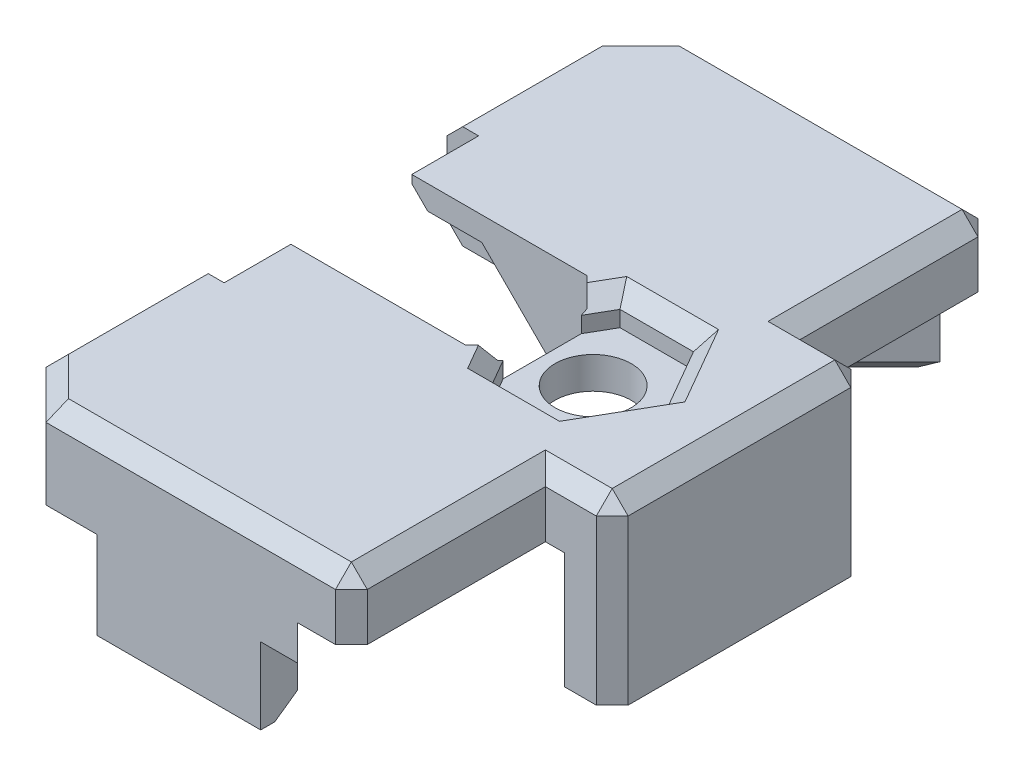
from build123d import *
from OCP.BRepFilletAPI import BRepFilletAPI_MakeChamfer

# Parameters (mm, degrees)
SKETCH1_W                = 13.2
SKETCH1_H                = 8
BOSS_EXTRUDE1_DEPTH      = 2
CUT_EXTRUDE1_DEPTH       = 12.914696807
CUT_EXTRUDE1_DEPTH_BACK  = 12.914696807
SKETCH3_W                = 2
SKETCH3_H                = 8
BOSS_EXTRUDE2_DEPTH      = 3.65
BOSS_EXTRUDE3_DEPTH      = 2
BOSS_EXTRUDE4_DEPTH      = 1.25
BOSS_EXTRUDE5_DEPTH      = 2.1
BOSS_EXTRUDE6_DEPTH      = 2.25
CHAMFER3_SIZE            = 1.5
CHAMFER4_SIZE            = 0.3
CHAMFER3_OF_MIRROR1_SIZE = 1.5
CHAMFER4_OF_MIRROR1_SIZE = 0.3
CUT_EXTRUDE2_DEPTH       = 15.141428499
CUT_EXTRUDE2_DEPTH_BACK  = 15.141428499
SKETCH10_W               = 1
SKETCH10_H               = 8
CUT_EXTRUDE3_DEPTH       = 15.418477728
CUT_EXTRUDE3_DEPTH_BACK  = 1
SKETCH12_W               = 6
SKETCH12_H               = 3.8
CUT_EXTRUDE4_DEPTH       = 15.418477728
CUT_EXTRUDE5_REACH       = 24.67
SKETCH13_W               = 1.15
SKETCH13_H               = 2.4
CHAMFER7_SIZE            = 0.5
CHAMFER7_SIZE_2          = 0.353553391
CUT_EXTRUDE6_REACH       = 15.658
SKETCH14_W               = 2
SKETCH14_H               = 1.25
CHAMFER8_SIZE            = 0.5


with BuildPart() as part:
    # Sketch1 → Boss-Extrude1 (new body)
    with BuildSketch(Plane(origin=(0, 0, 0), x_dir=(1, 0, 0), z_dir=(0, 1, 0))):
        with Locations((-2, 0)):
            Rectangle(SKETCH1_W, SKETCH1_H)
        with BuildLine():
            ThreePointArc((0, 1.2), (-1.2, 0), (0, -1.2))
            ThreePointArc((0, -1.2), (0.848528137, -0.848528137), (1.2, 0))
            ThreePointArc((1.2, 0), (0.848528137, 0.848528137), (0, 1.2))
        make_face(mode=Mode.SUBTRACT)
    extrude(amount=-BOSS_EXTRUDE1_DEPTH)

    # Sketch2 → Cut-Extrude1 (cut, two sides: drawn at the far end of the back side and taken through both)
    with BuildSketch(Plane(origin=(0, 0, -4), x_dir=(-1, 0, 0), z_dir=(0, 0, -1)).offset(-CUT_EXTRUDE1_DEPTH_BACK)):
        Polygon((8.6, -2), (8.6, -0.75), (3.75, -0.75), (2.5, -2), align=None)
    extrude(amount=CUT_EXTRUDE1_DEPTH + CUT_EXTRUDE1_DEPTH_BACK, mode=Mode.SUBTRACT)

    # Sketch3 → Boss-Extrude2 (add)
    with BuildSketch(Plane.XZ.offset(2)):
        with Locations((3.6, 0)):
            Rectangle(SKETCH3_W, SKETCH3_H)
    extrude(amount=BOSS_EXTRUDE2_DEPTH)

    # Sketch4 → Boss-Extrude3 (add)
    with BuildSketch(Plane(origin=(0, -2, 2), x_dir=(1, 0, 0), z_dir=(0, 1, 0))):
        Polygon((-8.6, -8.1), (0.8, -8.1), (2.5, -8.1), (2.5, -2), (0.8, -2), (-8.6, -2), align=None)
    boss_extrude3 = extrude(amount=BOSS_EXTRUDE3_DEPTH)

    # Sketch5 → Boss-Extrude4 (add)
    with BuildSketch(Plane.XZ.offset(2)):
        Polygon((-8.6, 10.1), (-6.6, 10.1), (-1.2, 10.1), (0.8, 10.1), (-1.2, 8.1), (-6.6, 8.1), (-6.6, 4), (-8.6, 4), align=None)
    boss_extrude4 = extrude(amount=BOSS_EXTRUDE4_DEPTH)

    # Sketch6 → Boss-Extrude5 (add)
    with BuildSketch(Plane(origin=(0, 0, 4), x_dir=(-1, 0, 0), z_dir=(0, 0, -1))):
        Polygon((2.5, -2), (2.5, -3.65), (5.4, -0.75), (3.75, -0.75), align=None)
    boss_extrude5 = extrude(amount=BOSS_EXTRUDE5_DEPTH)

    # Sketch8 → Boss-Extrude6 (add)
    with BuildSketch(Plane.XZ.offset(3.25)):
        Polygon((0.8, 10.1), (-1.2, 8.1), (-6, 8.1), (-6, 10.1), align=None)
    boss_extrude6 = extrude(amount=BOSS_EXTRUDE6_DEPTH)

    # Chamfer3
    chamfer3_edges = [part.edges().sort_by_distance(p)[0] for p in [
        (-8.6, -1.625, 10.1),
    ]]
    chamfer(chamfer3_edges, length=CHAMFER3_SIZE)

    # Chamfer4
    chamfer4_edges = [part.edges().sort_by_distance(p)[0] for p in [
        (-6.6, -2.625, 8.1),
    ]]
    chamfer(chamfer4_edges, length=CHAMFER4_SIZE)

    # Mirror1: Boss-Extrude3, Boss-Extrude4, Boss-Extrude5, Boss-Extrude6 across plane
    add(boss_extrude3.mirror(Plane.XY))
    add(boss_extrude4.mirror(Plane.XY))
    add(boss_extrude5.mirror(Plane.XY))
    add(boss_extrude6.mirror(Plane.XY))

    # Chamfer3 of Mirror1
    chamfer3_of_mirror1_edges = [part.edges().sort_by_distance(p)[0] for p in [
        (-8.6, -1.625, -10.1),
    ]]
    chamfer(chamfer3_of_mirror1_edges, length=CHAMFER3_OF_MIRROR1_SIZE)

    # Chamfer4 of Mirror1
    chamfer4_of_mirror1_edges = [part.edges().sort_by_distance(p)[0] for p in [
        (-6.6, -2.625, -8.1),
    ]]
    chamfer(chamfer4_of_mirror1_edges, length=CHAMFER4_OF_MIRROR1_SIZE)

    # Sketch10 → Cut-Extrude2 (cut, two sides: drawn at the far end of the back side and taken through both)
    with BuildSketch(Plane.XZ.offset(0.75).offset(-CUT_EXTRUDE2_DEPTH_BACK)):
        with Locations((-8.1, 0)):
            Rectangle(SKETCH10_W, SKETCH10_H)
    extrude(amount=CUT_EXTRUDE2_DEPTH + CUT_EXTRUDE2_DEPTH_BACK, mode=Mode.SUBTRACT)

    # Sketch11 → Cut-Extrude3 (cut, two sides: drawn at the far end of the back side and taken through both)
    with BuildSketch(Plane(origin=(0, 0, 0), x_dir=(1, 0, 0), z_dir=(0, 1, 0)).offset(-CUT_EXTRUDE3_DEPTH_BACK)):
        Polygon((1.154700538, -2), (-1.154700538, -2), (-1.212435565, -1.9), (-2.309401077, 0), (-1.212435565, 1.9), (-1.154700538, 2), (1.154700538, 2), (2.309401077, 0), align=None)
    extrude(amount=CUT_EXTRUDE3_DEPTH + CUT_EXTRUDE3_DEPTH_BACK, mode=Mode.SUBTRACT)

    # Sketch12 → Cut-Extrude4 (cut, through all)
    with BuildSketch(Plane(origin=(0, 0, 0), x_dir=(1, 0, 0), z_dir=(0, 1, 0))):
        with Locations((-4.6, 0)):
            Rectangle(SKETCH12_W, SKETCH12_H)
    extrude(amount=-CUT_EXTRUDE4_DEPTH, mode=Mode.SUBTRACT)

    # Sketch13 → Cut-Extrude5 (cut, up to next)
    with BuildSketch(Plane.XY.offset(10.1), mode=Mode.PRIVATE) as cut_extrude5_sk1:
        with Locations((0.225, -4.3)):
            Rectangle(SKETCH13_W, SKETCH13_H)
    cut_extrude5_tool1 = extrude(cut_extrude5_sk1.sketch, amount=-CUT_EXTRUDE5_REACH, mode=Mode.PRIVATE) & part.part
    add(cut_extrude5_tool1.solids().sort_by_distance((0.225, -4.3, 10.1))[0], mode=Mode.SUBTRACT)

    # Chamfer7
    chamfer7_edges = [part.edges().sort_by_distance(p)[0] for p in [
        (-1.6, -1, 1.9),
        (-1.6, -1, -1.9),
    ]]
    chamfer(chamfer7_edges, length=CHAMFER7_SIZE)
    chamfer7_2_edges_1 = [part.edges().sort_by_distance(p)[0] for p in [
        (-6.6, -3.25, -5.9),
        (-6.45, -3.25, -7.95),
        (-6.15, -3.25, -8.1),
        (-6.15, -3.25, 8.1),
        (-6.45, -3.25, 7.95),
        (-6.6, -3.25, 5.9),
        (-8.6, -3.25, 6.3),
        (-7.85, -3.25, 9.35),
        (-6.55, -3.25, 10.1),
        (-6, -4.375, 10.1),
        (-6, -4.375, -10.1),
        (-6.55, -3.25, -10.1),
        (-7.85, -3.25, -9.35),
        (-8.6, -3.25, -6.3),
        (-3.6, -5.5, 8.1),
        (-0.775, -5.5, 8.525),
        (-0.2, -5.5, -9.1),
        (-3.6, -5.5, -8.1),
        (2.6, -3.825, 4),
        (2.6, -3.825, -4),
        (2.6, -5.65, 0),
        (-1.377350269, 0, 1.614359354),
        (0, 0, 2),
        (1.732050808, 0, 1),
        (1.732050808, 0, -1),
        (0, 0, -2),
        (-1.377350269, 0, -1.614359354),
        (4.6, -2.825, -4),
        (4.6, -2.825, 4),
        (-8.6, 0, -6.3),
        (-7.85, 0, -9.35),
        (-8.6, 0, 6.3),
        (-7.85, 0, 9.35),
        (-2.3, 0, -10.1),
        (2.5, 0, -7.05),
        (3.55, 0, -4),
        (4.6, 0, 0),
        (3.55, 0, 4),
        (2.5, 0, 7.05),
        (-2.3, 0, 10.1),
        (2.5, -1, -10.1),
        (2.5, -1, 10.1),
        (-6, -4.375, 8.1),
        (-6, -4.375, -8.1),
        (-7.6, -0.75, 2.95),
        (-7.6, -0.75, -2.95),
    ]]
    chamfer7_2_edges_2 = [part.edges().sort_by_distance(p)[0] for p in [
        (-2.5, -3.65, -2.95),
    ]]
    chamfer7_2_side_2 = [part.faces().sort_by_distance(p)[0] for p in [
        (-2.5, -3.642928932, -2.95),
    ]]
    chamfer7_2_edges_3 = [part.edges().sort_by_distance(p)[0] for p in [
        (-2.5, -3.65, 2.95),
    ]]
    chamfer7_2_side_3 = [part.faces().sort_by_distance(p)[0] for p in [
        (-2.5, -3.642928932, 2.95),
    ]]
    chamfer7_2 = BRepFilletAPI_MakeChamfer(part.part.solid().wrapped)
    for e in chamfer7_2_edges_1:
        chamfer7_2.Add(CHAMFER7_SIZE, e.wrapped)
    for e in chamfer7_2_edges_2:
        chamfer7_2.Add(CHAMFER7_SIZE_2, CHAMFER7_SIZE, e.wrapped, chamfer7_2_side_2[0].wrapped)
    for e in chamfer7_2_edges_3:
        chamfer7_2.Add(CHAMFER7_SIZE_2, CHAMFER7_SIZE, e.wrapped, chamfer7_2_side_3[0].wrapped)
    add(Compound.cast(chamfer7_2.Shape()), mode=Mode.REPLACE)

    # Cut-Extrude6: up to this face of the body (flat: up to its plane)
    cut_extrude6_end = Plane(part.part.faces().sort_by_distance((1.4, -2, 9.875917426))[0])
    # Sketch14 → Cut-Extrude6 (cut, up to the picked face)
    with BuildSketch(Plane.XZ.offset(3.25), mode=Mode.PRIVATE) as cut_extrude6_sk1:
        with Locations((-7.6, -6.1)):
            Rectangle(SKETCH14_W, SKETCH14_H)
    cut_extrude6_tool1 = split(extrude(cut_extrude6_sk1.sketch, amount=-CUT_EXTRUDE6_REACH, mode=Mode.PRIVATE), bisect_by=cut_extrude6_end, keep=Keep.BOTH, mode=Mode.PRIVATE)
    # Sketch14 → Cut-Extrude6 (cut, up to the picked face)
    with BuildSketch(Plane.XZ.offset(3.25), mode=Mode.PRIVATE) as cut_extrude6_sk2:
        with Locations((-7.6, 6.1)):
            Rectangle(SKETCH14_W, SKETCH14_H)
    cut_extrude6_tool2 = split(extrude(cut_extrude6_sk2.sketch, amount=-CUT_EXTRUDE6_REACH, mode=Mode.PRIVATE), bisect_by=cut_extrude6_end, keep=Keep.BOTH, mode=Mode.PRIVATE)
    add(cut_extrude6_tool1.solids().sort_by(Axis((-7.6, -3.25, -6.1), (0, 1, 0)))[0], mode=Mode.SUBTRACT)
    add(cut_extrude6_tool2.solids().sort_by(Axis((-7.6, -3.25, 6.1), (0, 1, 0)))[0], mode=Mode.SUBTRACT)

    # Chamfer8
    chamfer8_edges = [part.edges().sort_by_distance(p)[0] for p in [
        (-8.6, -2, -6.1),
        (-8.6, -2, 6.1),
    ]]
    chamfer(chamfer8_edges, length=CHAMFER8_SIZE)


solid = part.part
